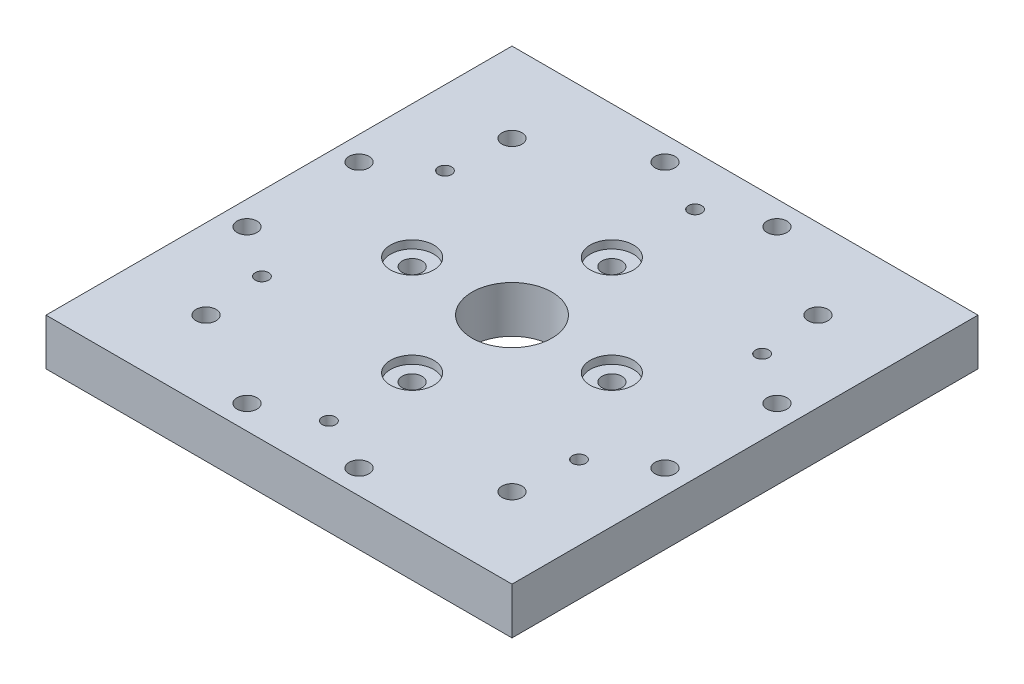
from build123d import *

# Parameters (mm, degrees)
SKETCH1_W           = 70
SKETCH1_H           = 70
SKETCH1_R           = 6
SKETCH1_R_2         = 1.5
SKETCH1_R_3         = 1
BOSS_EXTRUDE1_DEPTH = 7
SKETCH2_R           = 3.25
CUT_EXTRUDE1_DEPTH  = 1.2


with BuildPart() as part:
    # Sketch1 → Boss-Extrude1 (new body)
    with BuildSketch(Plane(origin=(0, 0, 0), x_dir=(1, 0, 0), z_dir=(0, 1, 0))):
        Rectangle(SKETCH1_W, SKETCH1_H)
        Circle(SKETCH1_R, mode=Mode.SUBTRACT)
        with Locations((0, 15)):
            Circle(SKETCH1_R_2, mode=Mode.SUBTRACT)
        with Locations((15, 0)):
            Circle(SKETCH1_R_2, mode=Mode.SUBTRACT)
        with Locations((0, -15)):
            Circle(SKETCH1_R_2, mode=Mode.SUBTRACT)
        with Locations((-15, 0)):
            Circle(SKETCH1_R_2, mode=Mode.SUBTRACT)
        with Locations((-31.392589354, -8.411618966)):
            Circle(SKETCH1_R_2, mode=Mode.SUBTRACT)
        with Locations((-31.392589354, 8.411618966)):
            Circle(SKETCH1_R_2, mode=Mode.SUBTRACT)
        with Locations((-22.980970389, 22.980970389)):
            Circle(SKETCH1_R_2, mode=Mode.SUBTRACT)
        with Locations((-8.411618966, 31.392589354)):
            Circle(SKETCH1_R_2, mode=Mode.SUBTRACT)
        with Locations((8.411618966, 31.392589354)):
            Circle(SKETCH1_R_2, mode=Mode.SUBTRACT)
        with Locations((22.980970389, 22.980970389)):
            Circle(SKETCH1_R_2, mode=Mode.SUBTRACT)
        with Locations((31.392589354, 8.411618966)):
            Circle(SKETCH1_R_2, mode=Mode.SUBTRACT)
        with Locations((31.392589354, -8.411618966)):
            Circle(SKETCH1_R_2, mode=Mode.SUBTRACT)
        with Locations((22.980970389, -22.980970389)):
            Circle(SKETCH1_R_2, mode=Mode.SUBTRACT)
        with Locations((8.411618966, -31.392589354)):
            Circle(SKETCH1_R_2, mode=Mode.SUBTRACT)
        with Locations((-8.411618966, -31.392589354)):
            Circle(SKETCH1_R_2, mode=Mode.SUBTRACT)
        with Locations((-22.980970389, -22.980970389)):
            Circle(SKETCH1_R_2, mode=Mode.SUBTRACT)
        with Locations((0, 27.5)):
            Circle(SKETCH1_R_3, mode=Mode.SUBTRACT)
        with Locations((23.815698604, 13.75)):
            Circle(SKETCH1_R_3, mode=Mode.SUBTRACT)
        with Locations((23.815698604, -13.75)):
            Circle(SKETCH1_R_3, mode=Mode.SUBTRACT)
        with Locations((0, -27.5)):
            Circle(SKETCH1_R_3, mode=Mode.SUBTRACT)
        with Locations((-23.815698604, -13.75)):
            Circle(SKETCH1_R_3, mode=Mode.SUBTRACT)
        with Locations((-23.815698604, 13.75)):
            Circle(SKETCH1_R_3, mode=Mode.SUBTRACT)
    extrude(amount=BOSS_EXTRUDE1_DEPTH)

    # Sketch2 → Cut-Extrude1 (cut)
    with BuildSketch(Plane(origin=(0, 7, 0), x_dir=(1, 0, 0), z_dir=(0, 1, 0))):
        with Locations((0, 15)):
            Circle(SKETCH2_R)
        with Locations((15, 0)):
            Circle(SKETCH2_R)
        with Locations((0, -15)):
            Circle(SKETCH2_R)
        with Locations((-15, 0)):
            Circle(SKETCH2_R)
    extrude(amount=-CUT_EXTRUDE1_DEPTH, mode=Mode.SUBTRACT)


solid = part.part
